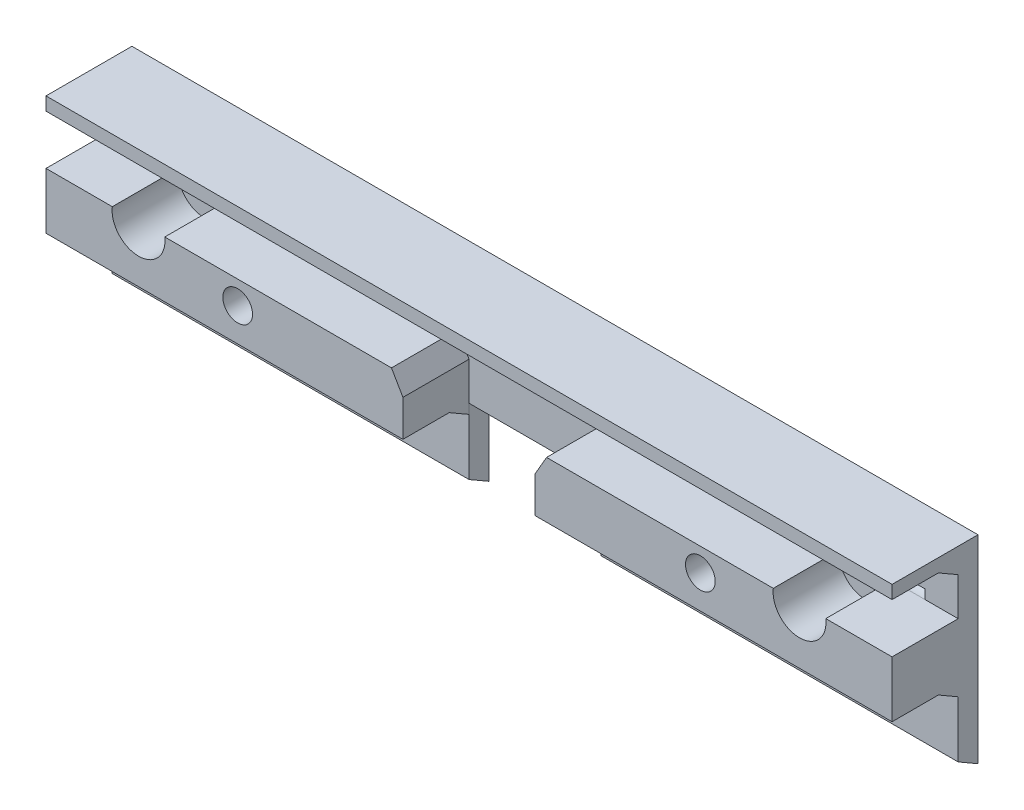
from build123d import *
from OCP.BRepFilletAPI import BRepFilletAPI_MakeChamfer

# Parameters (mm, degrees)
SKIZZE1_R                          = 1.65
SKIZZE1_R_2                        = 2.25
AUFSATZ_LINEAR_AUSTRAGEN1_DEPTH    = 3
SKIZZE2_W                          = 128
SKIZZE2_H                          = 2
SKIZZE2_R                          = 2.25
AUFSATZ_LINEAR_AUSTRAGEN2_DEPTH    = 10
FASE1_SIZE                         = 1.732050808
FASE1_SIZE_2                       = 3
FASE2_SIZE                         = 1.732050808
FASE2_SIZE_2                       = 3
SCHNITT_LINEAR_START               = -5
SCHNITT_LINEAR_AUSTRAGEN1_DEPTH    = 3
SCHNITT_LINEAR_START_2             = -41.26795
SCHNITT_LINEAR_AUSTRAGEN2_DEPTH    = 3
SCHNITT_LINEAR_START_3             = -8
SCHNITT_LINEAR_AUSTRAGEN3_DEPTH    = 3
SCHNITT_LINEAR_START_4             = -44.26795
SCHNITT_LINEAR_AUSTRAGEN4_DEPTH    = 3
K_RPER_VERSCHIEBEN_KOPIEREN1_ANGLE = 90


# Some blends are built 0.0001 mm under size
with BuildPart() as part:
    # Skizze1 → Aufsatz-Linear austragen1 (new body)
    with BuildSketch(Plane(origin=(0, 0, 0), x_dir=(1, 0, 0), z_dir=(0, 1, 0))):
        Polygon((54, -20), (74, -20), (74, -30), (128, -30), (128, 0), (0, 0), (0, -30), (54, -30), align=None)
        with Locations(Location((114, -10, 0), (0, 0, 90))):
            Circle(SKIZZE1_R, mode=Mode.SUBTRACT)
        with Locations(Location((14, -10, 0), (0, 0, 270))):
            Circle(SKIZZE1_R, mode=Mode.SUBTRACT)
        with Locations(Location((29, -13, 0), (0, 0, 270))):
            Circle(SKIZZE1_R_2, mode=Mode.SUBTRACT)
        with Locations(Location((99, -13, 0), (0, 0, 270))):
            Circle(SKIZZE1_R_2, mode=Mode.SUBTRACT)
    extrude(amount=AUFSATZ_LINEAR_AUSTRAGEN1_DEPTH)

    # Skizze2 → Aufsatz-Linear austragen2 (add)
    # profile 1 of 3: a face of its own
    with BuildSketch(Plane(origin=(0, 3, 0), x_dir=(1, 0, 0), z_dir=(0, 1, 0))):
        with Locations((64, -1)):
            Rectangle(SKIZZE2_W, SKIZZE2_H)
    # profile 2 of 3: a face of its own
    with BuildSketch(Plane(origin=(0, 3, 0), x_dir=(1, 0, 0), z_dir=(0, 1, 0))):
        with BuildLine():
            Line((0, -9.5), (10.031373033, -9.5))
            ThreePointArc((10.031373033, -9.5), (14, -14), (17.968626967, -9.5))
            Line((17.968626967, -9.5), (54, -9.5))
            Line((54, -9.5), (54, -18))
            Line((54, -18), (0, -18))
            Line((0, -18), (0, -9.5))
        make_face()
        with Locations(Location((29, -13, 0), (0, 0, 270))):
            Circle(SKIZZE2_R, mode=Mode.SUBTRACT)
    # profile 3 of 3: a face of its own
    with BuildSketch(Plane(origin=(0, 3, 0), x_dir=(1, 0, 0), z_dir=(0, 1, 0))):
        with BuildLine():
            Line((128, -9.5), (128, -18))
            Line((128, -18), (74, -18))
            Line((74, -18), (74, -9.5))
            Line((74, -9.5), (110.031373033, -9.5))
            ThreePointArc((110.031373033, -9.5), (114, -14), (117.968626967, -9.5))
            Line((117.968626967, -9.5), (128, -9.5))
        make_face()
        with Locations(Location((99, -13, 0), (0, 0, 270))):
            Circle(SKIZZE2_R, mode=Mode.SUBTRACT)
    extrude(amount=AUFSATZ_LINEAR_AUSTRAGEN2_DEPTH)

    # Fase1
    fase1_edges_1 = [part.edges().sort_by_distance(p)[0] for p in [
        (54, 8, 9.5),
    ]]
    fase1_side_1 = [part.faces().sort_by_distance(p)[0] for p in [
        (53.965358984, 8, 9.5),
    ]]
    fase1_edges_2 = [part.edges().sort_by_distance(p)[0] for p in [
        (74, 8, 9.5),
    ]]
    fase1_side_2 = [part.faces().sort_by_distance(p)[0] for p in [
        (74, 8, 9.534641016),
    ]]
    fase1_edges_3 = [part.edges().sort_by_distance(p)[0] for p in [
        (64, 3, 2),
    ]]
    fase1_side_3 = [part.faces().sort_by_distance(p)[0] for p in [
        (64, 3, 2.034641016),
    ]]
    fase1_edges_4 = [part.edges().sort_by_distance(p)[0] for p in [
        (27, 3, 18),
    ]]
    fase1_side_4 = [part.faces().sort_by_distance(p)[0] for p in [
        (27, 3, 18.034641016),
    ]]
    fase1_edges_5 = [part.edges().sort_by_distance(p)[0] for p in [
        (101, 3, 18),
    ]]
    fase1_side_5 = [part.faces().sort_by_distance(p)[0] for p in [
        (101, 3, 18.034641016),
    ]]
    fase1_edges_6 = [part.edges().sort_by_distance(p)[0] for p in [
        (27, 3, 30),
    ]]
    fase1_side_6 = [part.faces().sort_by_distance(p)[0] for p in [
        (27, 3, 29.965358984),
    ]]
    fase1_edges_7 = [part.edges().sort_by_distance(p)[0] for p in [
        (101, 3, 30),
    ]]
    fase1_side_7 = [part.faces().sort_by_distance(p)[0] for p in [
        (101, 3, 29.965358984),
    ]]
    fase1 = BRepFilletAPI_MakeChamfer(part.part.solid().wrapped)
    for e in fase1_edges_1:
        fase1.Add(FASE1_SIZE - 0.0001, FASE1_SIZE_2 - 0.0001, e.wrapped, fase1_side_1[0].wrapped)
    for e in fase1_edges_2:
        fase1.Add(FASE1_SIZE_2 - 0.0001, FASE1_SIZE - 0.0001, e.wrapped, fase1_side_2[0].wrapped)
    for e in fase1_edges_3:
        fase1.Add(FASE1_SIZE - 0.0001, FASE1_SIZE_2 - 0.0001, e.wrapped, fase1_side_3[0].wrapped)
    for e in fase1_edges_4:
        fase1.Add(FASE1_SIZE - 0.0001, FASE1_SIZE_2 - 0.0001, e.wrapped, fase1_side_4[0].wrapped)
    for e in fase1_edges_5:
        fase1.Add(FASE1_SIZE - 0.0001, FASE1_SIZE_2 - 0.0001, e.wrapped, fase1_side_5[0].wrapped)
    for e in fase1_edges_6:
        fase1.Add(FASE1_SIZE - 0.0001, FASE1_SIZE_2 - 0.0001, e.wrapped, fase1_side_6[0].wrapped)
    for e in fase1_edges_7:
        fase1.Add(FASE1_SIZE - 0.0001, FASE1_SIZE_2 - 0.0001, e.wrapped, fase1_side_7[0].wrapped)
    add(Compound.cast(fase1.Shape()), mode=Mode.REPLACE)  # a hair under: the kernel refuses the full size

    # Fase2
    # the kernel refuses this chamfer: 3, 1.732050808 mm, written as the material it takes off along each edge
    with BuildSketch(Plane(origin=(54, 3, 20), x_dir=(0, 0.057893862402670915, -0.9983227437537925), z_dir=(1, 0, 0))) as fase2_piece_1:
        Polygon((FASE2_SIZE * 0.998322743505, -FASE2_SIZE * 0.0578938623883), (-FASE2_SIZE_2 * 0.0578938624027, -FASE2_SIZE_2 * 0.998322743754), (0, 0), align=None)
    extrude(amount=20, mode=Mode.SUBTRACT)

    # Skizze3 → Schnitt-Linear austragen1 (cut)
    with BuildSketch(Plane(origin=(128, 0, 0), x_dir=(0, 0, -1), z_dir=(1, 0, 0)).offset(SCHNITT_LINEAR_START)):
        with BuildLine():
            Line((-9.5, 3), (-8.1, 3))
            ThreePointArc((-8.1, 3), (-7.807106781, 2.292893219), (-7.1, 2))
            Line((-7.1, 2), (-6.132050808, 2))
            ThreePointArc((-6.132050808, 2), (-5.424944026, 2.292893219), (-5.132050808, 3))
            Line((-5.132050808, 3), (-3.732050808, 3))
            ThreePointArc((-3.732050808, 3), (-4.434994533, 1.302943725), (-6.132050808, 0.6))
            Line((-6.132050808, 0.6), (-7.1, 0.6))
            ThreePointArc((-7.1, 0.6), (-8.797056275, 1.302943725), (-9.5, 3))
        make_face()
    extrude(amount=-SCHNITT_LINEAR_AUSTRAGEN1_DEPTH, mode=Mode.SUBTRACT)

    # Skizze4 → Schnitt-Linear austragen2 (cut)
    with BuildSketch(Plane(origin=(120, 0, 0), x_dir=(0, 0, -1), z_dir=(1, 0, 0)).offset(SCHNITT_LINEAR_START_2)):
        with BuildLine():
            Line((-7.1, 0.6), (-6.132050808, 0.6))
            ThreePointArc((-6.132050808, 0.6), (-4.434994533, 1.302943725), (-3.732050808, 3))
            Line((-3.732050808, 3), (-5.132050808, 3))
            ThreePointArc((-5.132050808, 3), (-5.424944026, 2.292893219), (-6.132050808, 2))
            Line((-6.132050808, 2), (-7.1, 2))
            ThreePointArc((-7.1, 2), (-7.807106781, 2.292893219), (-8.1, 3))
            Line((-8.1, 3), (-9.5, 3))
            ThreePointArc((-9.5, 3), (-8.797056275, 1.302943725), (-7.1, 0.6))
        make_face()
    extrude(amount=-SCHNITT_LINEAR_AUSTRAGEN2_DEPTH, mode=Mode.SUBTRACT)

    # Skizze5 → Schnitt-Linear austragen3 (cut)
    with BuildSketch(Plane.ZY.offset(SCHNITT_LINEAR_START_3)):
        with BuildLine():
            Line((9.5, 3), (8.1, 3))
            ThreePointArc((8.1, 3), (7.807106781, 2.292893219), (7.1, 2))
            Line((7.1, 2), (6.132050808, 2))
            ThreePointArc((6.132050808, 2), (5.424944026, 2.292893219), (5.132050808, 3))
            Line((5.132050808, 3), (3.732050808, 3))
            ThreePointArc((3.732050808, 3), (4.434994533, 1.302943725), (6.132050808, 0.6))
            Line((6.132050808, 0.6), (7.1, 0.6))
            ThreePointArc((7.1, 0.6), (8.797056275, 1.302943725), (9.5, 3))
        make_face()
    extrude(amount=SCHNITT_LINEAR_AUSTRAGEN3_DEPTH, mode=Mode.SUBTRACT)

    # Skizze6 → Schnitt-Linear austragen4 (cut)
    with BuildSketch(Plane.ZY.offset(-8).offset(SCHNITT_LINEAR_START_4)):
        with BuildLine():
            Line((9.5, 3), (8.1, 3))
            ThreePointArc((8.1, 3), (7.807106781, 2.292893219), (7.1, 2))
            Line((7.1, 2), (6.132050808, 2))
            ThreePointArc((6.132050808, 2), (5.424944026, 2.292893219), (5.132050808, 3))
            Line((5.132050808, 3), (3.732050808, 3))
            ThreePointArc((3.732050808, 3), (4.434994533, 1.302943725), (6.132050808, 0.6))
            Line((6.132050808, 0.6), (7.1, 0.6))
            ThreePointArc((7.1, 0.6), (8.797056275, 1.302943725), (9.5, 3))
        make_face()
    extrude(amount=SCHNITT_LINEAR_AUSTRAGEN4_DEPTH, mode=Mode.SUBTRACT)


with BuildPart() as part_1:
    # Körper-Verschieben/Kopieren1: moved
    add(part.part.rotate(Axis((0, 6.5, 15), (1, 0, 0)), K_RPER_VERSCHIEBEN_KOPIEREN1_ANGLE))


solid = part_1.part
